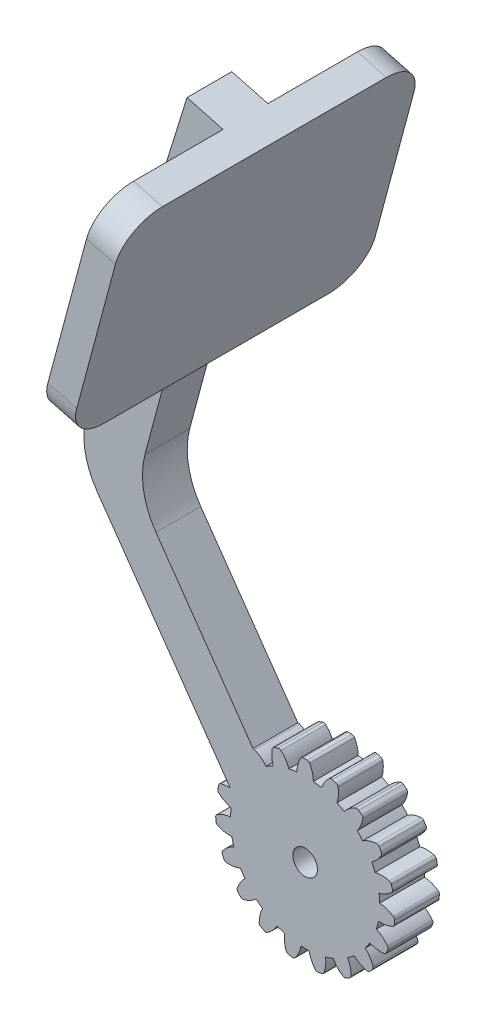
from build123d import *

# Parameters (mm, degrees)
SKETCH1_R                = 1.5
BOSS_EXTRUDE1_DEPTH      = 6
CIRPATTERN1_COUNT        = 19
BOSS_EXTRUDE2_DEPTH      = 6
CUT_EXTRUDE1_START       = -3
CUT_EXTRUDE1_OUTLINE_R   = 1.5
CUT_EXTRUDE1_DEPTH       = 3
CUT_EXTRUDE2_DEPTH       = 87.300505794
CUT_EXTRUDE2_DEPTH_BACK  = 87.300505794
SKETCH5_R                = 4.5
CUT_EXTRUDE3_DEPTH       = 87.143933621
CUT_EXTRUDE3_DEPTH_BACK  = 87.143933621
SKETCH6_R                = 1
BOSS_EXTRUDE3_DEPTH      = 3
BOSS_EXTRUDE3_DEPTH_BACK = 1
BOSS_EXTRUDE4_START      = -3
SKETCH8_R                = 1.65
BOSS_EXTRUDE4_DEPTH      = 6


# Read off the part's stored shape, not the designer's step: Cut-Extrude1
with BuildPart() as part:
    # Sketch1 → Boss-Extrude1 (new body)
    with BuildSketch(Plane.XY):
        with BuildLine():
            ThreePointArc((-1.1, 9.939315872), (0, -10), (1.1, 9.939315872))
            add(Edge.make_bspline(
                [(0.617344331, 11.790234813), (0.935178871, 11.214473497), (1.097039467, 10.593317902), (1.1, 9.939315872)],
                knots=[0.104246354, 0.104246354, 0.104246354, 0.104246354, 1, 1, 1, 1], degree=3))
            ThreePointArc((0.617344331, 11.790234813), (0.47442802, 11.939032873), (0.276370142, 11.996817059))
            ThreePointArc((0.276370142, 11.996817059), (0, 12), (-0.276370142, 11.996817059))
            ThreePointArc((-0.276370142, 11.996817059), (-0.47442802, 11.939032873), (-0.617344331, 11.790234813))
            add(Edge.make_bspline(
                [(-0.617344331, 11.790234813), (-0.935178871, 11.214473497), (-1.097039467, 10.593317902), (-1.1, 9.939315872)],
                knots=[0.104246354, 0.104246354, 0.104246354, 0.104246354, 1, 1, 1, 1], degree=3))
        make_face()
        Circle(SKETCH1_R, mode=Mode.SUBTRACT)
    boss_extrude1 = extrude(amount=BOSS_EXTRUDE1_DEPTH)

    # CirPattern1: Boss-Extrude1 ×19 about axis
    cirpattern1_axis = Axis((0, 0, 6), (0, 0, -1))
    for i in range(1, CIRPATTERN1_COUNT):
        add(boss_extrude1.rotate(cirpattern1_axis, i * 360 / CIRPATTERN1_COUNT))

    # Sketch2 → Boss-Extrude2 (add)
    with BuildSketch(Plane.XY.offset(6)):
        with BuildLine():
            Line((-2.585087734, 3.441458618), (-19.985632158, 28.292011454))
            ThreePointArc((-19.985632158, 28.292011454), (-21.642189246, 32.291294041), (-21.453369978, 36.615966268))
            Line((-21.453369978, 36.615966268), (-10.024203684, 79.270195567))
            Line((-10.024203684, 79.270195567), (-15.819758642, 80.823109837))
            Line((-15.819758642, 80.823109837), (-29.204081483, 37.761302549))
            ThreePointArc((-29.204081483, 37.761302549), (-29.53520577, 33.251797788), (-27.846236648, 29.057437313))
            Line((-27.846236648, 29.057437313), (-7.5, 0))
            Line((-7.5, 0), (-2.585087734, 3.441458618))
        make_face()
    extrude(amount=-BOSS_EXTRUDE2_DEPTH)

    # Cut-Extrude1 outline → Cut-Extrude1 (cut)
    with BuildSketch(Plane.XY.offset(6).offset(CUT_EXTRUDE1_START)):
        with BuildLine():
            Line((5.737256394, -3.055141415), (9.986319648, -0.522895679))
            ThreePointArc((9.986319648, -0.522895679), (9.999233448, -0.123816169), (9.996205349, 0.275460743))
            ThreePointArc((9.996205349, 0.275460743), (9.96584493, 0.825793455), (9.905209485, 1.373617506))
            ThreePointArc((9.905209485, 1.373617506), (9.694002659, 2.454854871), (9.365141414, 3.506298091))
            ThreePointArc((9.365141414, 3.506298091), (9.157733267, 4.016954247), (8.922505039, 4.515407383))
            ThreePointArc((8.922505039, 4.515407383), (8.371664783, 5.469481581), (7.719219091, 6.357173635))
            ThreePointArc((7.719219091, 6.357173635), (7.357239107, 6.772815716), (6.972908724, 7.167882806))
            ThreePointArc((6.972908724, 7.167882806), (6.914425734, 7.224314277), (6.855486062, 7.280268598))
            Line((6.855486062, 7.280268598), (2.034530077, 6.173385405))
            ThreePointArc((2.034530077, 6.173385405), (-2.420414622, 6.032544493), (-5.737256394, 3.055141415))
            Line((-5.737256394, 3.055141415), (-9.986319648, 0.522895679))
            ThreePointArc((-9.986319648, 0.522895679), (-9.992028439, 0.399208812), (-9.996205349, 0.275460743))
            ThreePointArc((-9.996205349, 0.275460743), (-9.96584493, -0.825793455), (-9.814530789, -1.917025141))
            ThreePointArc((-9.814530789, -1.917025141), (-9.694002659, -2.454854871), (-9.544025328, -2.985227051))
            ThreePointArc((-9.544025328, -2.985227051), (-9.157733267, -4.016954247), (-8.660295394, -4.999928369))
            ThreePointArc((-8.660295394, -4.999928369), (-8.371664783, -5.469481581), (-8.057602071, -5.922419173))
            ThreePointArc((-8.057602071, -5.922419173), (-7.487388609, -6.628650829), (-6.855486062, -7.280268598))
            Line((-6.855486062, -7.280268598), (-2.034530077, -6.173385405))
            ThreePointArc((-2.034530077, -6.173385405), (2.420414622, -6.032544493), (5.737256394, -3.055141415))
        make_face()
        Circle(CUT_EXTRUDE1_OUTLINE_R, mode=Mode.SUBTRACT)
    extrude(amount=CUT_EXTRUDE1_DEPTH, mode=Mode.SUBTRACT)

    # Sketch5 → Cut-Extrude2 (cut, two sides: drawn at the far end of the back side and taken through both)
    with BuildSketch(Plane(origin=(0, 0, 0), x_dir=(-1, 0, 0), z_dir=(0, 0, -1)).offset(-CUT_EXTRUDE2_DEPTH_BACK)):
        with Locations(Location((0, 0, 0), (0, 0, 180))):
            Circle(SKETCH5_R)
    extrude(amount=CUT_EXTRUDE2_DEPTH + CUT_EXTRUDE2_DEPTH_BACK, mode=Mode.SUBTRACT)

    # Sketch6 → Cut-Extrude3 (cut, two sides: drawn at the far end of the back side and taken through both)
    with BuildSketch(Plane.XY.offset(3).offset(-CUT_EXTRUDE3_DEPTH_BACK)):
        with Locations((-6.960628261, -2.792786102)):
            Circle(SKETCH6_R)
        with Locations((6.960628261, 2.792786102)):
            Circle(SKETCH6_R)
    extrude(amount=CUT_EXTRUDE3_DEPTH + CUT_EXTRUDE3_DEPTH_BACK, mode=Mode.SUBTRACT)

    # Sketch7 → Boss-Extrude3 (add, two sides: drawn at the far end of the back side and taken through both)
    with BuildSketch(Plane(origin=(-29.170258255, 7.816147143, 0), x_dir=(0, 0, -1), z_dir=(0.9659258262890682, -0.2588190451025211, 0)).offset(-BOSS_EXTRUDE3_DEPTH_BACK)):
        with BuildLine():
            Line((-18, 43.974674327), (12, 43.974674327))
            ThreePointArc((12, 43.974674327), (15.535533906, 45.439140421), (17, 48.974674327))
            Line((17, 48.974674327), (17, 68.974674327))
            ThreePointArc((17, 68.974674327), (15.535533906, 72.510208233), (12, 73.974674327))
            Line((12, 73.974674327), (-18, 73.974674327))
            ThreePointArc((-18, 73.974674327), (-21.535533906, 72.510208233), (-23, 68.974674327))
            Line((-23, 68.974674327), (-23, 48.974674327))
            ThreePointArc((-23, 48.974674327), (-21.535533906, 45.439140421), (-18, 43.974674327))
        make_face()
    extrude(amount=BOSS_EXTRUDE3_DEPTH + BOSS_EXTRUDE3_DEPTH_BACK)

    # Sketch8 → Boss-Extrude4 (add)
    with BuildSketch(Plane.XY.offset(3).offset(BOSS_EXTRUDE4_START)):
        with BuildLine():
            Line((-6.855486062, -7.280268598), (-2.034530077, -6.173385405))
            ThreePointArc((-2.034530077, -6.173385405), (2.420414621, -6.032544493), (5.737256394, -3.055141415))
            Line((5.737256394, -3.055141415), (9.986319648, -0.522895679))
            ThreePointArc((9.986319648, -0.522895679), (9.999233448, -0.123816168), (9.996205349, 0.275460743))
            ThreePointArc((9.996205349, 0.275460743), (9.96584493, 0.825793455), (9.905209485, 1.373617506))
            ThreePointArc((9.905209485, 1.373617506), (9.694002659, 2.454854871), (9.365141414, 3.506298091))
            ThreePointArc((9.365141414, 3.506298091), (9.157733267, 4.016954247), (8.922505039, 4.515407383))
            ThreePointArc((8.922505039, 4.515407383), (8.371664783, 5.469481581), (7.719219091, 6.357173635))
            ThreePointArc((7.719219091, 6.357173635), (7.357239107, 6.772815716), (6.972908724, 7.167882806))
            ThreePointArc((6.972908724, 7.167882806), (6.914425734, 7.224314277), (6.855486062, 7.280268598))
            Line((6.855486062, 7.280268598), (2.034530077, 6.173385405))
            ThreePointArc((2.034530077, 6.173385405), (-2.420414621, 6.032544493), (-5.737256394, 3.055141415))
            Line((-5.737256394, 3.055141415), (-9.986319648, 0.522895679))
            ThreePointArc((-9.986319648, 0.522895679), (-9.992028439, 0.399208812), (-9.996205349, 0.275460743))
            ThreePointArc((-9.996205349, 0.275460743), (-9.96584493, -0.825793455), (-9.814530789, -1.917025141))
            ThreePointArc((-9.814530789, -1.917025141), (-9.694002659, -2.454854871), (-9.544025328, -2.985227051))
            ThreePointArc((-9.544025328, -2.985227051), (-9.157733267, -4.016954247), (-8.660295394, -4.999928369))
            ThreePointArc((-8.660295394, -4.999928369), (-8.371664783, -5.469481581), (-8.057602071, -5.922419173))
            ThreePointArc((-8.057602071, -5.922419173), (-7.487388609, -6.628650829), (-6.855486062, -7.280268598))
        make_face()
        Circle(SKETCH8_R, mode=Mode.SUBTRACT)
    extrude(amount=BOSS_EXTRUDE4_DEPTH)


solid = part.part
